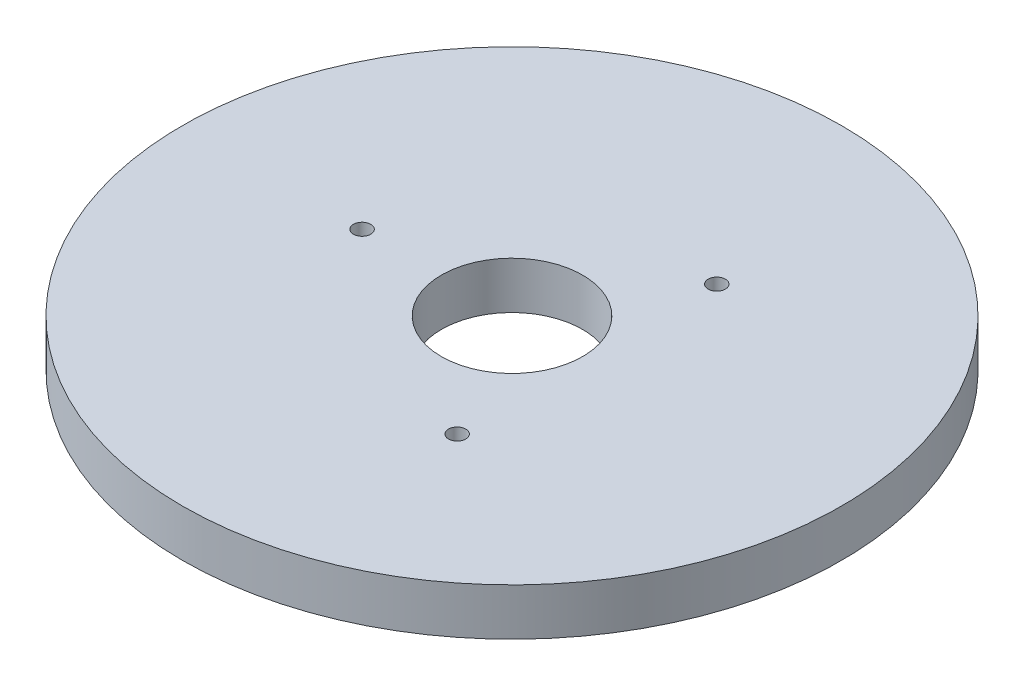
from build123d import *

# Parameters (mm, degrees)
SKETCH1_R           = 70
BOSS_EXTRUDE1_DEPTH = 10
SKETCH2_R           = 15
CUT_EXTRUDE1_DEPTH  = 100.498743711
SKETCH3_R           = 1.836356102
CUT_EXTRUDE2_DEPTH  = 6.979364856
CIRPATTERN1_COUNT   = 3


with BuildPart() as part:
    # Sketch1 → Boss-Extrude1 (new body)
    with BuildSketch(Plane(origin=(0, 0, 0), x_dir=(1, 0, 0), z_dir=(0, 1, 0))):
        Circle(SKETCH1_R)
    extrude(amount=BOSS_EXTRUDE1_DEPTH)

    # Sketch2 → Cut-Extrude1 (cut, through all)
    with BuildSketch(Plane(origin=(0, 0, 0), x_dir=(1, 0, 0), z_dir=(0, 1, 0))):
        Circle(SKETCH2_R)
    extrude(amount=CUT_EXTRUDE1_DEPTH, mode=Mode.SUBTRACT)

    # Sketch3 → Cut-Extrude2 (cut)
    with BuildSketch(Plane(origin=(0, 10, 0), x_dir=(1, 0, 0), z_dir=(0, 1, 0))):
        with Locations((-31.841606189, 0)):
            Circle(SKETCH3_R)
    cut_extrude2 = extrude(amount=-CUT_EXTRUDE2_DEPTH, mode=Mode.SUBTRACT)

    # CirPattern1: Cut-Extrude2 ×3 about axis
    cirpattern1_axis = Axis((0, 0, 0), (0, 1, 0))
    for i in range(1, CIRPATTERN1_COUNT):
        add(cut_extrude2.rotate(cirpattern1_axis, i * 360 / CIRPATTERN1_COUNT), mode=Mode.SUBTRACT)


solid = part.part
